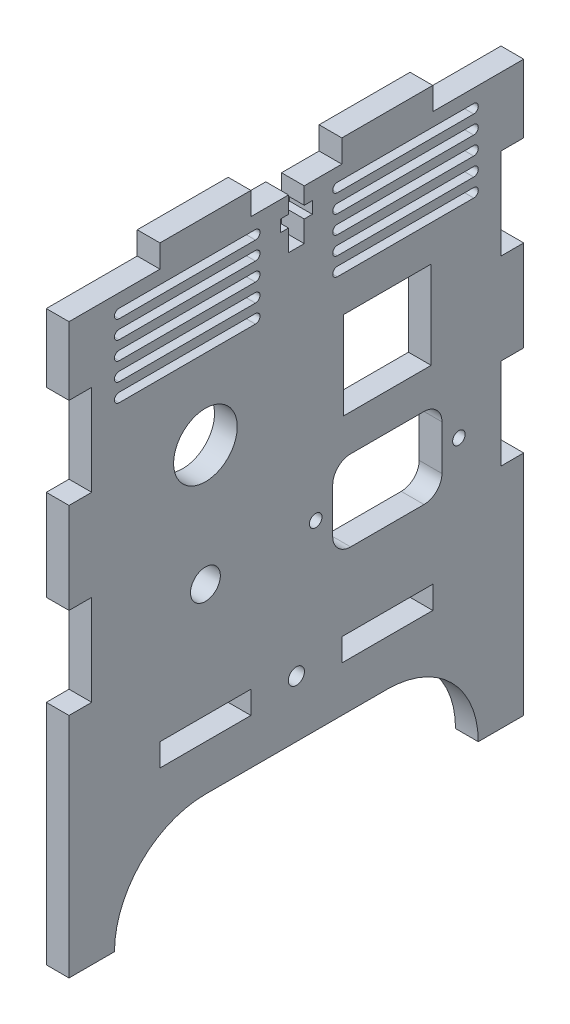
from build123d import *

# Parameters (mm, degrees)
SKETCH1_W                 = 127
SKETCH1_H                 = 165.1
BOSS_EXTRUDE1_DEPTH       = 6.35
SKETCH2_W                 = 25.4
SKETCH2_H                 = 6.35
CUT_EXTRUDE1_DEPTH        = 6.35
LPATTERN1_COUNT           = 3
LPATTERN1_PITCH           = 50.8
CUT_EXTRUDE4_DEPTH        = 6.35
SKETCH8_W                 = 6.35
SKETCH8_H                 = 25.4
CUT_EXTRUDE6_DEPTH        = 6.35
LPATTERN4_COUNT           = 2
LPATTERN4_PITCH           = 50.8
MIRROR1_COPY_1_SKETCH_W   = 6.35
MIRROR1_COPY_1_SKETCH_H   = 25.4
MIRROR1_COPY_1_DEPTH      = 6.35
MIRROR1_COPY_2_SKETCH_W   = 6.35
MIRROR1_COPY_2_SKETCH_H   = 25.4
MIRROR1_COPY_2_DEPTH      = 6.35
SKETCH9_W                 = 25.4
SKETCH9_H                 = 6.35
CUT_EXTRUDE7_DEPTH        = 6.35
LPATTERN6_COUNT           = 2
LPATTERN6_PITCH           = 50.8
SKETCH16_W                = 4.3942
SKETCH16_H                = 13.97
SKETCH16_W_2              = 8.89
SKETCH16_H_2              = 3.302
CUT_EXTRUDE14_DEPTH       = 6.35
F_8_CLEARANCE_HOLE1_D     = 4.4958
F_8_CLEARANCE_HOLE1_DEPTH = 10.16
F_8_CLEARANCE_HOLE1_TIP   = 1.350674586
CUT_EXTRUDE15_DEPTH       = 6.35
LPATTERN7_COPY_1_DEPTH    = 6.35
LPATTERN7_COPY_2_DEPTH    = 6.35
LPATTERN7_COPY_3_DEPTH    = 6.35
LPATTERN7_COPY_4_DEPTH    = 6.35
LPATTERN7_COPY_5_DEPTH    = 6.35
LPATTERN7_COPY_6_DEPTH    = 6.35
LPATTERN7_COPY_7_DEPTH    = 6.35
LPATTERN7_COPY_8_DEPTH    = 6.35
SKETCH20_R                = 1.75
CUT_EXTRUDE16_DEPTH       = 7.62
SKETCH22_W                = 24.5
SKETCH22_H                = 24.5
CUT_EXTRUDE17_DEPTH       = 6.35
SKETCH23_R                = 8.89
CUT_EXTRUDE18_DEPTH       = 7.62
SKETCH24_R                = 4.1671875
CUT_EXTRUDE19_DEPTH       = 7.62


with BuildPart() as part:
    # Sketch1 → Boss-Extrude1 (new body)
    with BuildSketch(Plane(origin=(0, 0, 0), x_dir=(0, 0, -1), z_dir=(1, 0, 0))):
        Rectangle(SKETCH1_W, SKETCH1_H)
    extrude(amount=BOSS_EXTRUDE1_DEPTH)

    # Sketch2 → Cut-Extrude1 (cut)
    with BuildSketch(Plane(origin=(6.35, 0, 0), x_dir=(0, 0, -1), z_dir=(1, 0, 0))):
        with Locations((-50.8, 79.375)):
            Rectangle(SKETCH2_W, SKETCH2_H)
    cut_extrude1 = extrude(amount=-CUT_EXTRUDE1_DEPTH, mode=Mode.SUBTRACT)

    # LPattern1: Cut-Extrude1 ×3
    with Locations(*[(0, 0, -i * LPATTERN1_PITCH) for i in range(1, LPATTERN1_COUNT)]):
        add(cut_extrude1, mode=Mode.SUBTRACT)

    # Sketch5 → Cut-Extrude4 (cut)
    with BuildSketch(Plane(origin=(6.35, 0, 0), x_dir=(0, 0, -1), z_dir=(1, 0, 0))):
        with BuildLine():
            Line((-25.4, -57.15), (25.4, -57.15))
            ThreePointArc((25.4, -57.15), (50.8, -82.55), (25.4, -107.95))
            Line((25.4, -107.95), (-25.4, -107.95))
            ThreePointArc((-25.4, -107.95), (-50.8, -82.55), (-25.4, -57.15))
        make_face()
    extrude(amount=-CUT_EXTRUDE4_DEPTH, mode=Mode.SUBTRACT)

    # Sketch8 → Cut-Extrude6 (cut)
    with BuildSketch(Plane(origin=(6.35, 0, 0), x_dir=(0, 0, -1), z_dir=(1, 0, 0))):
        with Locations((60.325, 44.45)):
            Rectangle(SKETCH8_W, SKETCH8_H)
    cut_extrude6 = extrude(amount=-CUT_EXTRUDE6_DEPTH, mode=Mode.SUBTRACT)

    # LPattern4: Cut-Extrude6 ×2
    with Locations(*[(0, -i * LPATTERN4_PITCH, 0) for i in range(1, LPATTERN4_COUNT)]):
        add(cut_extrude6, mode=Mode.SUBTRACT)

    # Mirror1 copy 1 sketch → Mirror1 copy 1 (cut)
    with BuildSketch(Plane(origin=(6.35, -50.8, 0), x_dir=(0, 0, 1), z_dir=(1, 0, 0))):
        with Locations((60.325, -44.45)):
            Rectangle(MIRROR1_COPY_1_SKETCH_W, MIRROR1_COPY_1_SKETCH_H)
    extrude(amount=-MIRROR1_COPY_1_DEPTH, mode=Mode.SUBTRACT)

    # Mirror1 copy 2 sketch → Mirror1 copy 2 (cut)
    with BuildSketch(Plane(origin=(6.35, 0, 0), x_dir=(0, 0, 1), z_dir=(1, 0, 0))):
        with Locations((60.325, -44.45)):
            Rectangle(MIRROR1_COPY_2_SKETCH_W, MIRROR1_COPY_2_SKETCH_H)
    extrude(amount=-MIRROR1_COPY_2_DEPTH, mode=Mode.SUBTRACT)

    # Sketch9 → Cut-Extrude7 (cut)
    with BuildSketch(Plane.ZY):
        with Locations((-25.4, -41.275)):
            Rectangle(SKETCH9_W, SKETCH9_H)
    cut_extrude7 = extrude(amount=-CUT_EXTRUDE7_DEPTH, mode=Mode.SUBTRACT)

    # LPattern6: Cut-Extrude7 ×2
    with Locations(*[(0, 0, i * LPATTERN6_PITCH) for i in range(1, LPATTERN6_COUNT)]):
        add(cut_extrude7, mode=Mode.SUBTRACT)

    # Sketch16 → Cut-Extrude14 (cut)
    with BuildSketch(Plane.ZY):
        with Locations((0, 69.215)):
            Rectangle(SKETCH16_W, SKETCH16_H)
        with Locations((0, 69.85)):
            Rectangle(SKETCH16_W_2, SKETCH16_H_2)
    extrude(amount=-CUT_EXTRUDE14_DEPTH, mode=Mode.SUBTRACT)

    # #8 Clearance Hole1
    with Locations(Plane.ZY):
        with Locations((0, -41.275)):
            Hole(F_8_CLEARANCE_HOLE1_D / 2, depth=F_8_CLEARANCE_HOLE1_DEPTH)
            with Locations((0, 0, -(F_8_CLEARANCE_HOLE1_DEPTH + F_8_CLEARANCE_HOLE1_TIP / 2))):  # 118° drill point
                Cone(0, F_8_CLEARANCE_HOLE1_D / 2, F_8_CLEARANCE_HOLE1_TIP, mode=Mode.SUBTRACT)

    # Sketch19 → Cut-Extrude15 (cut)
    with BuildSketch(Plane.ZY):
        with BuildLine():
            Line((-49.53, 72.448860523), (-11.43, 72.448860523))
            ThreePointArc((-11.43, 72.448860523), (-10.16, 71.178860523), (-11.43, 69.908860523))
            Line((-11.43, 69.908860523), (-49.53, 69.908860523))
            ThreePointArc((-49.53, 69.908860523), (-50.8, 71.178860523), (-49.53, 72.448860523))
        make_face()
    cut_extrude15 = extrude(amount=-CUT_EXTRUDE15_DEPTH, mode=Mode.SUBTRACT)

    # Mirror2: Cut-Extrude15 across plane
    add(cut_extrude15.mirror(Plane.XY), mode=Mode.SUBTRACT)

    # LPattern7 copy 1 sketch → LPattern7 copy 1 (cut)
    with BuildSketch(Plane(origin=(0, -5.08, 0), x_dir=(0, 0, -1), z_dir=(-1, 0, 0))):
        with BuildLine():
            Line((-49.53, -72.448860523), (-11.43, -72.448860523))
            ThreePointArc((-11.43, -72.448860523), (-10.16, -71.178860523), (-11.43, -69.908860523))
            Line((-11.43, -69.908860523), (-49.53, -69.908860523))
            ThreePointArc((-49.53, -69.908860523), (-50.8, -71.178860523), (-49.53, -72.448860523))
        make_face()
    extrude(amount=-LPATTERN7_COPY_1_DEPTH, mode=Mode.SUBTRACT)

    # LPattern7 copy 2 sketch → LPattern7 copy 2 (cut)
    with BuildSketch(Plane(origin=(0, -10.16, 0), x_dir=(0, 0, -1), z_dir=(-1, 0, 0))):
        with BuildLine():
            Line((-49.53, -72.448860523), (-11.43, -72.448860523))
            ThreePointArc((-11.43, -72.448860523), (-10.16, -71.178860523), (-11.43, -69.908860523))
            Line((-11.43, -69.908860523), (-49.53, -69.908860523))
            ThreePointArc((-49.53, -69.908860523), (-50.8, -71.178860523), (-49.53, -72.448860523))
        make_face()
    extrude(amount=-LPATTERN7_COPY_2_DEPTH, mode=Mode.SUBTRACT)

    # LPattern7 copy 3 sketch → LPattern7 copy 3 (cut)
    with BuildSketch(Plane(origin=(0, -15.24, 0), x_dir=(0, 0, -1), z_dir=(-1, 0, 0))):
        with BuildLine():
            Line((-49.53, -72.448860523), (-11.43, -72.448860523))
            ThreePointArc((-11.43, -72.448860523), (-10.16, -71.178860523), (-11.43, -69.908860523))
            Line((-11.43, -69.908860523), (-49.53, -69.908860523))
            ThreePointArc((-49.53, -69.908860523), (-50.8, -71.178860523), (-49.53, -72.448860523))
        make_face()
    extrude(amount=-LPATTERN7_COPY_3_DEPTH, mode=Mode.SUBTRACT)

    # LPattern7 copy 4 sketch → LPattern7 copy 4 (cut)
    with BuildSketch(Plane(origin=(0, -20.32, 0), x_dir=(0, 0, -1), z_dir=(-1, 0, 0))):
        with BuildLine():
            Line((-49.53, -72.448860523), (-11.43, -72.448860523))
            ThreePointArc((-11.43, -72.448860523), (-10.16, -71.178860523), (-11.43, -69.908860523))
            Line((-11.43, -69.908860523), (-49.53, -69.908860523))
            ThreePointArc((-49.53, -69.908860523), (-50.8, -71.178860523), (-49.53, -72.448860523))
        make_face()
    extrude(amount=-LPATTERN7_COPY_4_DEPTH, mode=Mode.SUBTRACT)

    # LPattern7 copy 5 sketch → LPattern7 copy 5 (cut)
    with BuildSketch(Plane(origin=(0, -5.08, 0), x_dir=(0, 0, 1), z_dir=(-1, 0, 0))):
        with BuildLine():
            Line((-49.53, 72.448860523), (-11.43, 72.448860523))
            ThreePointArc((-11.43, 72.448860523), (-10.16, 71.178860523), (-11.43, 69.908860523))
            Line((-11.43, 69.908860523), (-49.53, 69.908860523))
            ThreePointArc((-49.53, 69.908860523), (-50.8, 71.178860523), (-49.53, 72.448860523))
        make_face()
    extrude(amount=-LPATTERN7_COPY_5_DEPTH, mode=Mode.SUBTRACT)

    # LPattern7 copy 6 sketch → LPattern7 copy 6 (cut)
    with BuildSketch(Plane(origin=(0, -10.16, 0), x_dir=(0, 0, 1), z_dir=(-1, 0, 0))):
        with BuildLine():
            Line((-49.53, 72.448860523), (-11.43, 72.448860523))
            ThreePointArc((-11.43, 72.448860523), (-10.16, 71.178860523), (-11.43, 69.908860523))
            Line((-11.43, 69.908860523), (-49.53, 69.908860523))
            ThreePointArc((-49.53, 69.908860523), (-50.8, 71.178860523), (-49.53, 72.448860523))
        make_face()
    extrude(amount=-LPATTERN7_COPY_6_DEPTH, mode=Mode.SUBTRACT)

    # LPattern7 copy 7 sketch → LPattern7 copy 7 (cut)
    with BuildSketch(Plane(origin=(0, -15.24, 0), x_dir=(0, 0, 1), z_dir=(-1, 0, 0))):
        with BuildLine():
            Line((-49.53, 72.448860523), (-11.43, 72.448860523))
            ThreePointArc((-11.43, 72.448860523), (-10.16, 71.178860523), (-11.43, 69.908860523))
            Line((-11.43, 69.908860523), (-49.53, 69.908860523))
            ThreePointArc((-49.53, 69.908860523), (-50.8, 71.178860523), (-49.53, 72.448860523))
        make_face()
    extrude(amount=-LPATTERN7_COPY_7_DEPTH, mode=Mode.SUBTRACT)

    # LPattern7 copy 8 sketch → LPattern7 copy 8 (cut)
    with BuildSketch(Plane(origin=(0, -20.32, 0), x_dir=(0, 0, 1), z_dir=(-1, 0, 0))):
        with BuildLine():
            Line((-49.53, 72.448860523), (-11.43, 72.448860523))
            ThreePointArc((-11.43, 72.448860523), (-10.16, 71.178860523), (-11.43, 69.908860523))
            Line((-11.43, 69.908860523), (-49.53, 69.908860523))
            ThreePointArc((-49.53, 69.908860523), (-50.8, 71.178860523), (-49.53, 72.448860523))
        make_face()
    extrude(amount=-LPATTERN7_COPY_8_DEPTH, mode=Mode.SUBTRACT)

    # Sketch20 → Cut-Extrude16 (cut)
    with BuildSketch(Plane.ZY):
        with Locations((-45.4, -6.35)):
            Circle(SKETCH20_R)
        with Locations((-5.4, -6.35)):
            Circle(SKETCH20_R)
        with BuildLine():
            Line((-35.65, 4.9), (-15.15, 4.9))
            ThreePointArc((-15.15, 4.9), (-11.614466094, 3.435533906), (-10.15, -0.1))
            Line((-10.15, -0.1), (-10.15, -12.6))
            ThreePointArc((-10.15, -12.6), (-11.614466094, -16.135533906), (-15.15, -17.6))
            Line((-15.15, -17.6), (-35.65, -17.6))
            ThreePointArc((-35.65, -17.6), (-39.185533906, -16.135533906), (-40.65, -12.6))
            Line((-40.65, -12.6), (-40.65, -0.1))
            ThreePointArc((-40.65, -0.1), (-39.185533906, 3.435533906), (-35.65, 4.9))
        make_face()
    extrude(amount=-CUT_EXTRUDE16_DEPTH, mode=Mode.SUBTRACT)

    # Sketch22 → Cut-Extrude17 (cut)
    with BuildSketch(Plane.ZY):
        with Locations((-25.4, 27.31)):
            Rectangle(SKETCH22_W, SKETCH22_H)
    extrude(amount=-CUT_EXTRUDE17_DEPTH, mode=Mode.SUBTRACT)

    # Sketch23 → Cut-Extrude18 (cut)
    with BuildSketch(Plane.ZY):
        with Locations((25.4, 27.31)):
            Circle(SKETCH23_R)
    extrude(amount=-CUT_EXTRUDE18_DEPTH, mode=Mode.SUBTRACT)

    # Sketch24 → Cut-Extrude19 (cut)
    with BuildSketch(Plane.ZY):
        with Locations((25.4, -6.35)):
            Circle(SKETCH24_R)
    extrude(amount=-CUT_EXTRUDE19_DEPTH, mode=Mode.SUBTRACT)


solid = part.part
